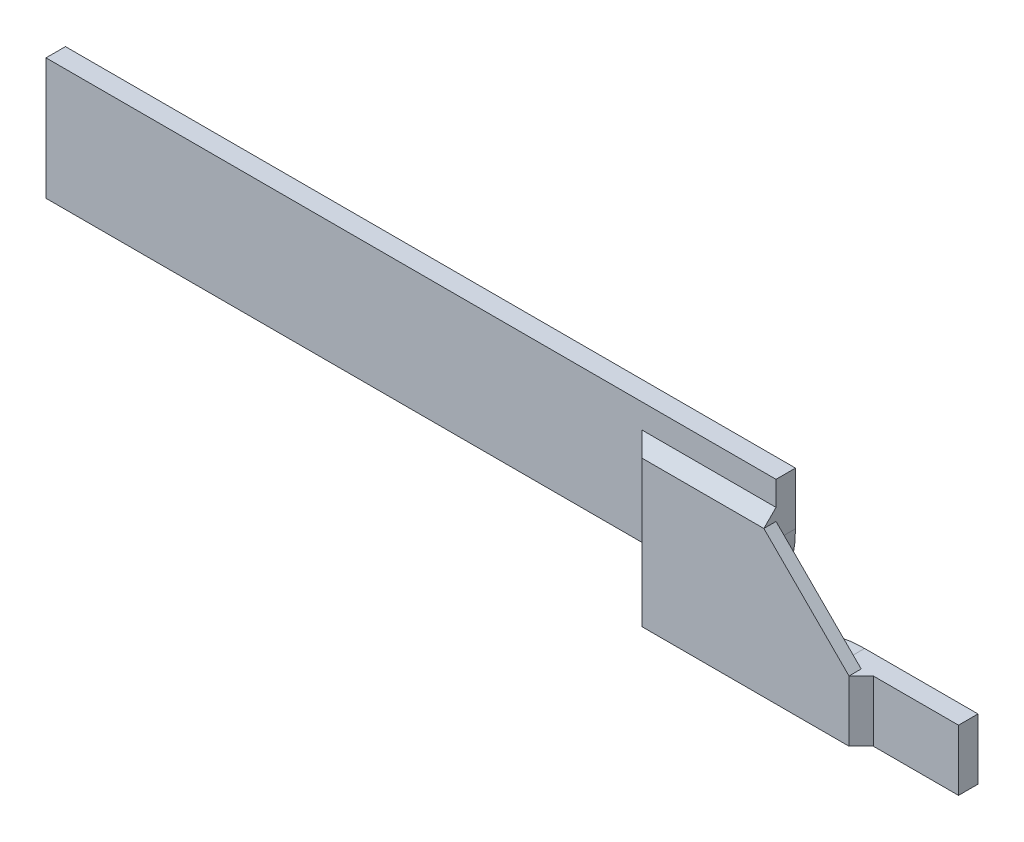
from build123d import *

# Parameters (mm, degrees)
RESSALTO_EXTRUS_O1_DEPTH = 1.6
RESSALTO_EXTRUS_O2_DEPTH = 1
CHANFRO1_SIZE            = 1
FILETE1_R                = 10


with BuildPart() as part:
    # Esboço1 → Ressalto-extrusão1 (new body)
    with BuildSketch(Plane.XY):
        with BuildLine():
            Line((0, 0), (50, 0))
            Line((50, 0), (50, -5))
            Line((50, -5), (75, -5))
            Line((75, -5), (75, 0))
            Line((75, 0), (61.5, 0))
            ThreePointArc((61.5, 0), (58.939339828, -1.060660172), (60, 1.5))
            Line((60, 1.5), (60, 10))
            Line((60, 10), (0, 10))
            Line((0, 10), (0, 0))
        make_face()
    extrude(amount=RESSALTO_EXTRUS_O1_DEPTH)

    # Esboço2 → Ressalto-extrusão2 (add)
    with BuildSketch(Plane.XY.offset(1.6)):
        Polygon((60, 7), (67, 0), (67, -5), (50, -5), (50, 7), align=None)
    extrude(amount=RESSALTO_EXTRUS_O2_DEPTH)

    # Chanfro1
    # the kernel refuses this chamfer: 1 mm, written as the material it adds along each edge
    with BuildSketch(Plane(origin=(50, 7, 1.6), x_dir=(0, 0.9996219169112968, -0.02749587661058627), z_dir=(1, 0, 0))) as chanfro1_piece_1_section:
        Polygon((CHANFRO1_SIZE * 0.999621916911, CHANFRO1_SIZE * 0.0274958766106), (-CHANFRO1_SIZE * 0.0274958766106, CHANFRO1_SIZE * 0.999621916911), (0, 0), align=None)
    chanfro1_piece_1 = extrude(amount=10, mode=Mode.PRIVATE)
    chanfro1_piece_1 = split(chanfro1_piece_1, bisect_by=Plane(origin=(57.256943657, 9.743056343, 1.932086514), z_dir=(-0.7071067811865478, -0.7071067811865474, 0)), keep=Keep.TOP, mode=Mode.PRIVATE)
    chanfro1_piece_1 = split(chanfro1_piece_1, bisect_by=Plane(origin=(54.837757031, 7.323869717, 2.6), z_dir=(0, 0, -1)), keep=Keep.TOP, mode=Mode.PRIVATE)
    add(chanfro1_piece_1)
    with BuildSketch(Plane(origin=(50, 7, 1.6), x_dir=(0, 0.9996219169112968, -0.02749587661058627), z_dir=(1, 0, 0))) as chanfro1_piece_2_section:
        Polygon((CHANFRO1_SIZE * 0.999621916911, CHANFRO1_SIZE * 0.0274958766106), (-CHANFRO1_SIZE * 0.0274958766106, CHANFRO1_SIZE * 0.999621916911), (0, 0), align=None)
    chanfro1_piece_2 = extrude(amount=10, mode=Mode.PRIVATE)
    chanfro1_piece_2 = split(chanfro1_piece_2, bisect_by=Plane(origin=(59.609036426, 7.390963574, 1.827791028), z_dir=(0.7071067811865478, 0.7071067811865474, 0)), keep=Keep.TOP, mode=Mode.PRIVATE)
    add(chanfro1_piece_2)
    with BuildSketch(Plane(origin=(50, 0, 1.6), x_dir=(-0.9996219169112968, 0, -0.0274958766105862), z_dir=(0, 1, 0))) as chanfro1_piece_3_section:
        Polygon((CHANFRO1_SIZE * 0.999621916911, CHANFRO1_SIZE * 0.0274958766106), (-CHANFRO1_SIZE * 0.0274958766106, CHANFRO1_SIZE * 0.999621916911), (0, 0), align=None)
    chanfro1_piece_3 = extrude(amount=7, mode=Mode.PRIVATE)
    chanfro1_piece_3 = split(chanfro1_piece_3, bisect_by=Plane(origin=(49.669595846, 3.5, 2.6), z_dir=(0, 0, -1)), keep=Keep.TOP, mode=Mode.PRIVATE)
    add(chanfro1_piece_3)
    with BuildSketch(Plane(origin=(67, 0, 1.6), x_dir=(0.9996219169112968, 0, -0.02749587661058639), z_dir=(0, -1, 0))) as chanfro1_piece_4_section:
        Polygon((CHANFRO1_SIZE * 0.999621916911, CHANFRO1_SIZE * 0.0274958766106), (-CHANFRO1_SIZE * 0.0274958766106, CHANFRO1_SIZE * 0.999621916911), (0, 0), align=None)
    chanfro1_piece_4 = extrude(amount=5, mode=Mode.PRIVATE)
    chanfro1_piece_4 = split(chanfro1_piece_4, bisect_by=Plane(origin=(67.390963574, -0.390963574, 1.827791028), z_dir=(0.7071067811865478, 0.7071067811865474, 0)), keep=Keep.TOP, mode=Mode.PRIVATE)
    add(chanfro1_piece_4)
    with BuildSketch(Plane(origin=(67, 0, 1.6), x_dir=(0.9996219169112968, 0, -0.02749587661058639), z_dir=(0, -1, 0))) as chanfro1_piece_5_section:
        Polygon((CHANFRO1_SIZE * 0.999621916911, CHANFRO1_SIZE * 0.0274958766106), (-CHANFRO1_SIZE * 0.0274958766106, CHANFRO1_SIZE * 0.999621916911), (0, 0), align=None)
    chanfro1_piece_5 = extrude(amount=5, mode=Mode.PRIVATE)
    chanfro1_piece_5 = split(chanfro1_piece_5, bisect_by=Plane(origin=(67.316872032, -2.658755048, 2.6), z_dir=(0, 0, -1)), keep=Keep.TOP, mode=Mode.PRIVATE)
    chanfro1_piece_5 = split(chanfro1_piece_5, bisect_by=Plane(origin=(68.48781354, -1.48781354, 1.93578343), z_dir=(-0.7071067811865478, -0.7071067811865474, 0)), keep=Keep.TOP, mode=Mode.PRIVATE)
    add(chanfro1_piece_5)
    with BuildSketch(Plane(origin=(47.428317012, 7, 1.6), x_dir=(0, 0.9996219169112968, -0.02749587661058627), z_dir=(1, 0, 0))) as chanfro1_piece_6a_section:
        Polygon((CHANFRO1_SIZE * 0.999621916911, CHANFRO1_SIZE * 0.0274958766106), (-CHANFRO1_SIZE * 0.0274958766106, CHANFRO1_SIZE * 0.999621916911), (0, 0), align=None)
    chanfro1_piece_6a = extrude(amount=12.571682988, mode=Mode.PRIVATE)
    chanfro1_piece_6a = split(chanfro1_piece_6a, bisect_by=Plane(origin=(50, 7.330404154, 1.928634334), z_dir=(-1, 0, 0)), keep=Keep.TOP, mode=Mode.PRIVATE)
    chanfro1_piece_6a = split(chanfro1_piece_6a, bisect_by=Plane(origin=(48.714158506, 7.330404154, 2.6), z_dir=(0, 0, -1)), keep=Keep.TOP, mode=Mode.PRIVATE)
    with BuildSketch(Plane(origin=(50, 0, 1.6), x_dir=(-0.9996219169112968, 0, -0.0274958766105862), z_dir=(0, 1, 0))) as chanfro1_piece_6b_section:
        Polygon((CHANFRO1_SIZE * 0.999621916911, CHANFRO1_SIZE * 0.0274958766106), (-CHANFRO1_SIZE * 0.0274958766106, CHANFRO1_SIZE * 0.999621916911), (0, 0), align=None)
    chanfro1_piece_6b = extrude(amount=9.571682988, mode=Mode.PRIVATE)
    chanfro1_piece_6b = split(chanfro1_piece_6b, bisect_by=Plane(origin=(49.669595846, 7, 1.928634334), z_dir=(0, 1, 0)), keep=Keep.TOP, mode=Mode.PRIVATE)
    chanfro1_piece_6b = split(chanfro1_piece_6b, bisect_by=Plane(origin=(49.669595846, 8.285841494, 2.6), z_dir=(0, 0, -1)), keep=Keep.TOP, mode=Mode.PRIVATE)
    chanfro1_piece_6 = chanfro1_piece_6a & chanfro1_piece_6b
    add(chanfro1_piece_6)

    # Filete1
    filete1_edges = [part.edges().sort_by_distance(p)[0] for p in [
        (60, 1.5, 0.8),
        (61.5, 0, 0.8),
    ]]
    fillet(filete1_edges, radius=FILETE1_R)


solid = part.part
